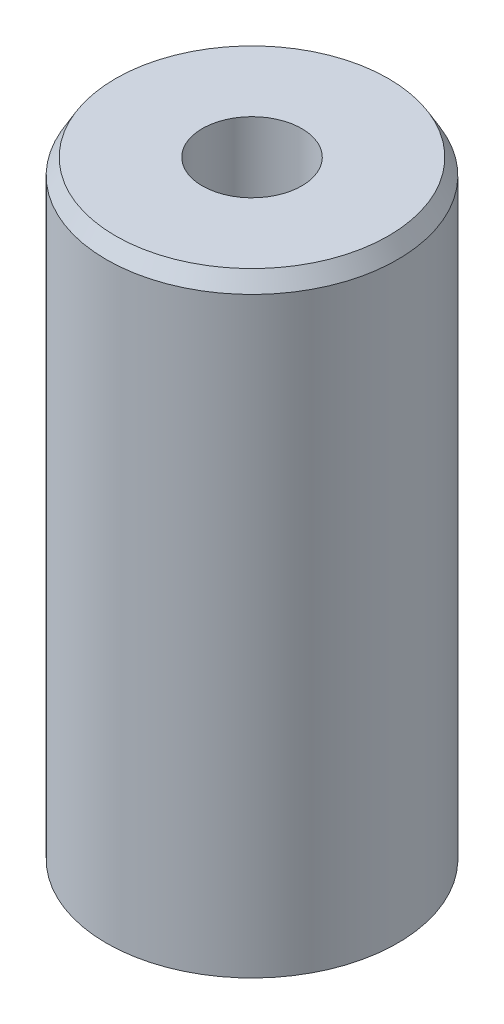
from build123d import *
from OCP.BRepFilletAPI import BRepFilletAPI_MakeChamfer

# Parameters (mm, degrees)
SKETCH1_R           = 42.5
BOSS_EXTRUDE1_DEPTH = 180.160392053
SKETCH2_R           = 14.516966848
CUT_EXTRUDE1_DEPTH  = 190.921738789
CHAMFER1_SIZE       = 4.644640424
CHAMFER1_SIZE2      = 2.681584399


with BuildPart() as part:
    # Sketch1 → Boss-Extrude1 (new body)
    with BuildSketch(Plane(origin=(0, 0, 0), x_dir=(1, 0, 0), z_dir=(0, 1, 0))):
        Circle(SKETCH1_R)
    extrude(amount=BOSS_EXTRUDE1_DEPTH)

    # Sketch2 → Cut-Extrude1 (cut, through all)
    with BuildSketch(Plane(origin=(0, 0, 0), x_dir=(1, 0, 0), z_dir=(0, 1, 0))):
        Circle(SKETCH2_R)
    extrude(amount=CUT_EXTRUDE1_DEPTH, mode=Mode.SUBTRACT)

    # Chamfer1: one chamfer whose edges measure the first distance from different faces: ONE call of the kernel's chamfer builder (chamfer() names one face for all edges)
    chamfer1_edges_1 = [part.edges().sort_by_distance(p)[0] for p in [
        (-42.5, 180.160392053, 0),
    ]]
    chamfer1_side_1 = [part.faces().sort_by_distance(p)[0] for p in [
        (-42.5, 90.080196027, 0),
    ]]
    chamfer1_edges_2 = [part.edges().sort_by_distance(p)[0] for p in [
        (-42.5, 0, 0),
    ]]
    chamfer1_side_2 = [part.faces().sort_by_distance(p)[0] for p in [
        (-41.297918472, 0, 0),
    ]]
    chamfer1 = BRepFilletAPI_MakeChamfer(part.part.solid().wrapped)
    for e in chamfer1_edges_1:
        chamfer1.Add(CHAMFER1_SIZE, CHAMFER1_SIZE2, e.wrapped, chamfer1_side_1[0].wrapped)  # the first distance lies on this face
    for e in chamfer1_edges_2:
        chamfer1.Add(CHAMFER1_SIZE, CHAMFER1_SIZE2, e.wrapped, chamfer1_side_2[0].wrapped)  # the first distance lies on this face
    add(Compound.cast(chamfer1.Shape()), mode=Mode.REPLACE)


solid = part.part
